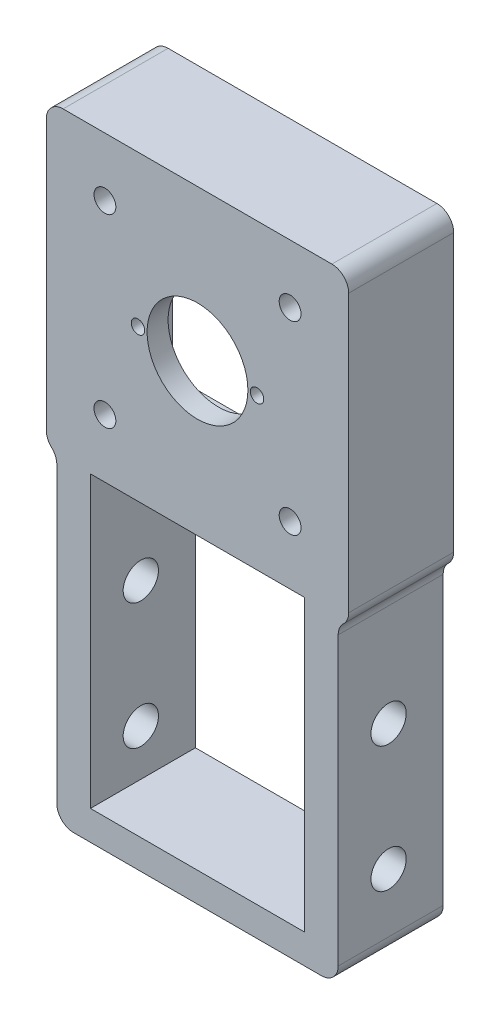
from build123d import *

# Parameters (mm, degrees)
SKETCH1_W                = 39.37
SKETCH1_H                = 39.37
SKETCH1_R                = 1.651
SKETCH1_R_2              = 7.62
SKETCH1_R_3              = 1.016
BOSS_EXTRUDE1_DEPTH      = 3.175
BOSS_EXTRUDE2_DEPTH      = 12.7
BOSS_EXTRUDE2_DEPTH_BACK = 3.175
SKETCH3_W                = 45.72
SKETCH3_H                = 45.72
SKETCH3_W_2              = 39.37
SKETCH3_H_2              = 39.37
SKETCH5_W                = 5.08
SKETCH5_H                = 15.875
BOSS_EXTRUDE3_DEPTH      = 48.26
SKETCH6_W                = 42.545
SKETCH6_H                = 15.875
BOSS_EXTRUDE4_DEPTH      = 4.445
SKETCH7_R                = 2.667
CUT_EXTRUDE1_DEPTH       = 70.979765826
FILLET1_R                = 2.54
FILLET2_R                = 2.54
FILLET3_R                = 2.54


with BuildPart() as part:
    # Sketch1 → Boss-Extrude1 (new body)
    with BuildSketch(Plane.XY):
        with Locations((-19.685, 19.685)):
            Rectangle(SKETCH1_W, SKETCH1_H)
        with Locations((-33.68548, 5.68452)):
            Circle(SKETCH1_R, mode=Mode.SUBTRACT)
        with Locations((-33.68548, 33.68548)):
            Circle(SKETCH1_R, mode=Mode.SUBTRACT)
        with Locations((-5.68452, 5.68452)):
            Circle(SKETCH1_R, mode=Mode.SUBTRACT)
        with Locations((-5.68452, 33.68548)):
            Circle(SKETCH1_R, mode=Mode.SUBTRACT)
        with Locations((-19.685, 19.685)):
            Circle(SKETCH1_R_2, mode=Mode.SUBTRACT)
        with Locations((-28.68549, 19.685)):
            Circle(SKETCH1_R_3, mode=Mode.SUBTRACT)
        with Locations((-10.68451, 19.685)):
            Circle(SKETCH1_R_3, mode=Mode.SUBTRACT)
    extrude(amount=BOSS_EXTRUDE1_DEPTH)

    # Sketch3 → Boss-Extrude2 (add, two sides: drawn at the far end of the back side and taken through both)
    with BuildSketch(Plane(origin=(0, 0, 0), x_dir=(-1, 0, 0), z_dir=(0, 0, -1)).offset(-BOSS_EXTRUDE2_DEPTH_BACK)):
        with Locations((19.685, 19.685)):
            Rectangle(SKETCH3_W, SKETCH3_H)
        with Locations((19.685, 19.685)):
            Rectangle(SKETCH3_W_2, SKETCH3_H_2, mode=Mode.SUBTRACT)
    extrude(amount=BOSS_EXTRUDE2_DEPTH + BOSS_EXTRUDE2_DEPTH_BACK)

    # Sketch5 → Boss-Extrude3 (add)
    with BuildSketch(Plane(origin=(0, -3.175, 0), x_dir=(-1, 0, 0), z_dir=(0, -1, 0))):
        with Locations((38.4175, 4.7625)):
            Rectangle(SKETCH5_W, SKETCH5_H)
        with Locations((0.9525, 4.7625)):
            Rectangle(SKETCH5_W, SKETCH5_H)
    extrude(amount=BOSS_EXTRUDE3_DEPTH)

    # Sketch6 → Boss-Extrude4 (add)
    with BuildSketch(Plane(origin=(-35.8775, -51.435, -12.7), x_dir=(1, 0, 0), z_dir=(0, 1, 0))):
        with Locations((16.1925, -7.9375)):
            Rectangle(SKETCH6_W, SKETCH6_H)
    extrude(amount=BOSS_EXTRUDE4_DEPTH)

    # Sketch7 → Cut-Extrude1 (cut, through all)
    with BuildSketch(Plane.ZY.offset(42.545)):
        with Locations(Location((-4.445, -40.005, 0), (0, 0, 90))):
            Circle(SKETCH7_R)
        with Locations(Location((-4.445, -20.955, 0), (0, 0, 90))):
            Circle(SKETCH7_R)
    extrude(amount=-CUT_EXTRUDE1_DEPTH, mode=Mode.SUBTRACT)

    # Fillet1
    # the kernel refuses this fillet: 2.54 mm, written as the material it adds along each edge
    with BuildSketch(Plane(origin=(1.5875, -3.175, 3.175), x_dir=(1, 0, 0), z_dir=(0, 0, -1))) as fillet1_piece_1:
        with BuildLine():
            CenterArc((2.54, 2.35464302), FILLET1_R, 180, 67.975687163)
            Line((0, 2.35464302), (0, 0))
            Line((0, 0), (1.5875, 0))
        make_face()
    extrude(amount=15.875)
    # the kernel refuses this fillet: 2.54 mm, written as the material it takes off along each edge
    with BuildSketch(Plane(origin=(-40.9575, -51.435, -19.05), x_dir=(1, 0, 0), z_dir=(0, 0, 1))) as fillet1_2_piece_1:
        with BuildLine():
            CenterArc((FILLET1_R, FILLET1_R), FILLET1_R, 180, 90)
            Line((0, FILLET1_R), (0, 0))
            Line((0, 0), (FILLET1_R, 0))
        make_face()
    extrude(amount=28.575, mode=Mode.SUBTRACT)
    with BuildSketch(Plane(origin=(1.5875, -51.435, 9.525), x_dir=(0, 1, 0), z_dir=(0, 0, -1))) as fillet1_2_piece_2:
        with BuildLine():
            CenterArc((FILLET1_R, -FILLET1_R), FILLET1_R, 90, 90)
            Line((0, -FILLET1_R), (0, 0))
            Line((0, 0), (FILLET1_R, 0))
        make_face()
    extrude(amount=28.575, mode=Mode.SUBTRACT)

    # Fillet2
    # the kernel refuses this fillet: 2.54 mm, written as the material it takes off along each edge
    with BuildSketch(Plane(origin=(-42.545, -3.175, 9.061607549), x_dir=(1, 0, 0), z_dir=(0, 0, -1))) as fillet2_piece_1:
        with BuildLine():
            CenterArc((2.54, -2.35464302), FILLET2_R, 112.024312837, 67.975687163)
            Line((0, -2.35464302), (-0.0508, -2.35464302))
            Line((-0.0508, -2.35464302), (-0.0508, 0))
            Line((-0.0508, 0), (0, 0.0508))
            ThreePointArc((0, 0.0508), (0.79375, 0.0508), (1.56845, 0.04709286))
            Line((1.56845, 0.04709286), (1.5875, 0))
        make_face()
    extrude(amount=27.648215098, mode=Mode.SUBTRACT)
    with BuildSketch(Plane(origin=(3.175, 42.545, -19.05), x_dir=(0, -1, 0), z_dir=(0, 0, 1))) as fillet2_piece_2:
        with BuildLine():
            CenterArc((FILLET2_R, -FILLET2_R), FILLET2_R, 90, 90)
            Line((0, -FILLET2_R), (-FILLET2_R * 0.02, -FILLET2_R))
            Line((-FILLET2_R * 0.02, -FILLET2_R), (-FILLET2_R * 0.02, FILLET2_R * 0.02))
            Line((-FILLET2_R * 0.02, FILLET2_R * 0.02), (FILLET2_R, FILLET2_R * 0.02))
            Line((FILLET2_R, FILLET2_R * 0.02), (FILLET2_R, 0))
        make_face()
    extrude(amount=28.575, mode=Mode.SUBTRACT)
    with BuildSketch(Plane(origin=(-42.545, 42.545, 9.525), x_dir=(1, 0, 0), z_dir=(0, 0, -1))) as fillet2_piece_3:
        with BuildLine():
            CenterArc((FILLET2_R, FILLET2_R), FILLET2_R, 180, 90)
            Line((0, FILLET2_R), (-FILLET2_R * 0.02, FILLET2_R))
            Line((-FILLET2_R * 0.02, FILLET2_R), (-FILLET2_R * 0.02, -FILLET2_R * 0.02))
            Line((-FILLET2_R * 0.02, -FILLET2_R * 0.02), (FILLET2_R, -FILLET2_R * 0.02))
            Line((FILLET2_R, -FILLET2_R * 0.02), (FILLET2_R, 0))
        make_face()
    extrude(amount=28.575, mode=Mode.SUBTRACT)
    with BuildSketch(Plane(origin=(3.175, -3.175, -16.035934044), x_dir=(-0.8412426627142054, -0.5406577313139188, 0), z_dir=(0, 0, 1))) as fillet2_piece_4:
        with BuildLine():
            CenterArc((1.41531695, -2.495802653), FILLET2_R, 100.70411186, 46.567463442)
            Line((-0.721439413, -1.122532015), (-0.76417454, -1.095066602))
            Line((-0.76417454, -1.095066602), (-0.042735127, 0.027465413))
            Line((-0.042735127, 0.027465413), (0.009435446, 0.049916053))
            ThreePointArc((0.009435446, 0.049916053), (0.471772317, 0.006602653), (0.934109187, 0.049916053))
            Line((0.934109187, 0.049916053), (0.943544634, 0))
        make_face()
    extrude(amount=22.546868088, mode=Mode.SUBTRACT)

    # Fillet3
    fillet3_edges = [part.edges().sort_by_distance(p)[0] for p in [
        (-40.9575, -3.175, -4.7625),
    ]]
    fillet(fillet3_edges, radius=FILLET3_R)


solid = part.part
